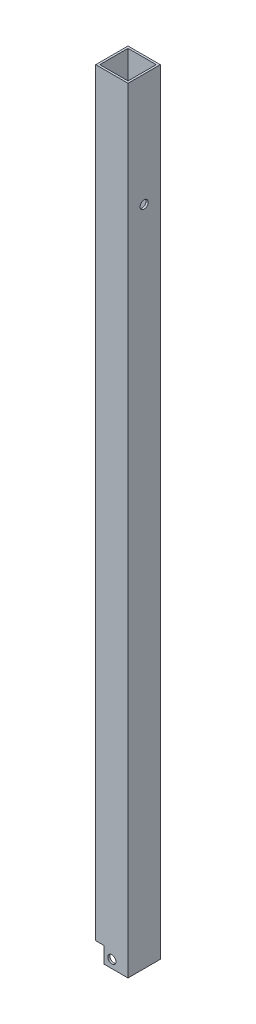
from build123d import *

# Parameters (mm, degrees)
SKETCH1_W           = 25.4
SKETCH1_H           = 25.4
SKETCH1_W_2         = 22.225
SKETCH1_H_2         = 22.225
BOSS_EXTRUDE1_DEPTH = 609.6
SKETCH2_W           = 6.35
SKETCH2_H           = 12.7
CUT_EXTRUDE1_DEPTH  = 25.4
SKETCH3_R           = 3.175
CUT_EXTRUDE2_DEPTH  = 25.4
SKETCH4_R           = 3.175
CUT_EXTRUDE3_DEPTH  = 25.4


with BuildPart() as part:
    # Sketch1 → Boss-Extrude1 (new body)
    with BuildSketch(Plane(origin=(0, 0, 0), x_dir=(1, 0, 0), z_dir=(0, 1, 0))):
        Rectangle(SKETCH1_W, SKETCH1_H)
        Rectangle(SKETCH1_W_2, SKETCH1_H_2, mode=Mode.SUBTRACT)
    extrude(amount=BOSS_EXTRUDE1_DEPTH)

    # Sketch2 → Cut-Extrude1 (cut)
    with BuildSketch(Plane.XY.offset(12.7)):
        with Locations((-9.525, 6.35)):
            Rectangle(SKETCH2_W, SKETCH2_H)
    extrude(amount=-CUT_EXTRUDE1_DEPTH, mode=Mode.SUBTRACT)

    # Sketch3 → Cut-Extrude2 (cut)
    with BuildSketch(Plane.XY.offset(12.7)):
        with Locations((0, 6.35)):
            Circle(SKETCH3_R)
    extrude(amount=-CUT_EXTRUDE2_DEPTH, mode=Mode.SUBTRACT)

    # Sketch4 → Cut-Extrude3 (cut)
    with BuildSketch(Plane(origin=(12.7, 0, 0), x_dir=(0, 0, -1), z_dir=(1, 0, 0))):
        with Locations((0, 520.7)):
            Circle(SKETCH4_R)
    extrude(amount=-CUT_EXTRUDE3_DEPTH, mode=Mode.SUBTRACT)


solid = part.part
